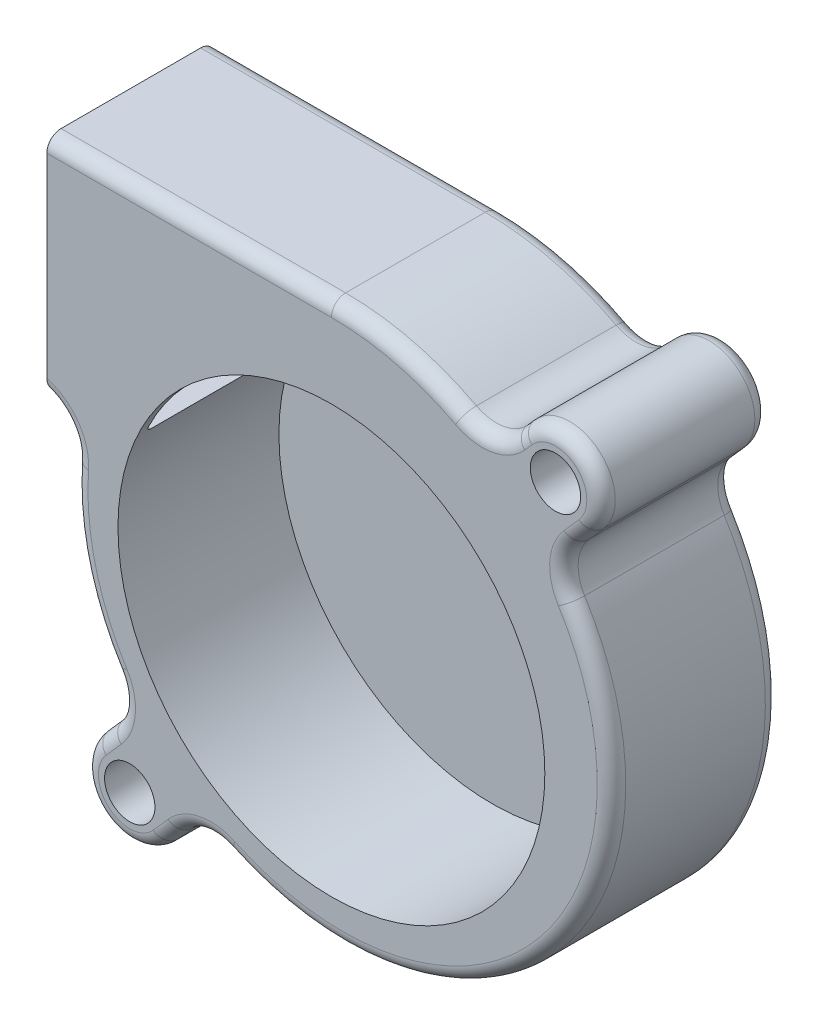
from build123d import *

# Parameters (mm, degrees)
SKETCH1_R           = 19.05
SKETCH1_R_2         = 2.2479
BOSS_EXTRUDE2_DEPTH = 15
FILLET1_R           = 3.81
FILLET2_R           = 1.27
SKETCH2_R           = 19.05
BOSS_EXTRUDE3_DEPTH = 0.635
CUT_EXTRUDE1_DEPTH  = 26.035


with BuildPart() as part:
    # Sketch1 → Boss-Extrude2 (new body)
    with BuildSketch(Plane.XY):
        with BuildLine():
            Line((-25.4, 7), (-25.4, 27))
            Line((-25.4, 27), (0, 27))
            ThreePointArc((0, 27), (7.440223944, 25.871137622), (14.210761067, 22.586158219))
            Line((14.210761067, 22.586158219), (16.954726597, 25.691171845))
            ThreePointArc((16.954726597, 25.691171845), (22.691171845, 26.045273403), (23.045273403, 20.308828155))
            Line((23.045273403, 20.308828155), (19.708510775, 16.533017813))
            ThreePointArc((19.708510775, 16.533017813), (18.983898052, -14.392747115), (-11.617963969, -18.915361503))
            Line((-11.617963969, -18.915361503), (-14.954726597, -22.691171845))
            ThreePointArc((-14.954726597, -22.691171845), (-20.691171845, -23.045273403), (-21.045273403, -17.308828155))
            Line((-21.045273403, -17.308828155), (-17.708510775, -13.533017813))
            ThreePointArc((-17.708510775, -13.533017813), (-22.406586632, -3.803932714), (-22.361292772, 7))
            Line((-22.361292772, 7), (-25.4, 7))
        make_face()
        Circle(SKETCH1_R, mode=Mode.SUBTRACT)
        with Locations((-18, -20)):
            Circle(SKETCH1_R_2, mode=Mode.SUBTRACT)
        with Locations((20, 23)):
            Circle(SKETCH1_R_2, mode=Mode.SUBTRACT)
    extrude(amount=BOSS_EXTRUDE2_DEPTH)

    # Fillet1
    # the kernel refuses this fillet: 3.81 mm, written as the material it adds along each edge
    with BuildSketch(Plane(origin=(14.210761067, 22.586158219, 0), x_dir=(-0.8559717678532165, 0.517022564921725, 0), z_dir=(0, 0, 1))) as fillet1_piece_1:
        with BuildLine():
            CenterArc((3.179243746, -3.803385338), FILLET1_R, 93.37669496, 76.288341739)
            Line((-0.568941844, -3.119861536), (-0.643905555, -3.10619106))
            Line((-0.643905555, -3.10619106), (-0.074963712, 0.013670476))
            Line((-0.074963712, 0.013670476), (0.004488206, 0.076067707))
            ThreePointArc((0.004488206, 0.076067707), (1.477416735, 0.032652027), (2.950345264, 0.076067707))
            Line((2.950345264, 0.076067707), (2.95483347, 0))
        make_face()
    extrude(amount=15)
    with BuildSketch(Plane(origin=(19.708510775, 16.533017813, 0), x_dir=(0.662197796471711, 0.7493290854811459, 0), z_dir=(0, 0, 1)), Plane(origin=(-17.708510775, -13.533017813, 0), x_dir=(-0.6621977964717104, -0.7493290854811463, 0), z_dir=(0, 0, 1))) as fillet1_piece_2:
        with BuildLine():
            CenterArc((3.018599897, -3.81), FILLET1_R, 90, 73.552565618)
            Line((-0.635494519, -2.731253506), (-0.708576407, -2.709678576))
            ThreePointArc((-0.708576407, -2.709678576), (-0.352039979, -1.357647693), (-0.075099583, 0.0129032))
            Line((-0.075099583, 0.0129032), (0, 0.0762))
            Line((0, 0.0762), (3.018599897, 0.0762))
            Line((3.018599897, 0.0762), (3.018599897, 0))
        make_face()
    extrude(amount=15)
    with BuildSketch(Plane(origin=(-11.617963969, -18.915361503, 0), x_dir=(0.8799019811914369, -0.4751552414689165, 0), z_dir=(0, 0, 1))) as fillet1_piece_3:
        with BuildLine():
            CenterArc((3.026795184, -3.803492639), FILLET1_R, 93.349187231, 73.552565618)
            Line((-0.684079668, -2.940064684), (-0.758297165, -2.922796125))
            Line((-0.758297165, -2.922796125), (-0.074217497, 0.017268559))
            Line((-0.074217497, 0.017268559), (0.004451685, 0.076069853))
            ThreePointArc((0.004451685, 0.076069853), (1.40210547, 0.035208749), (2.799759255, 0.076069853))
            Line((2.799759255, 0.076069853), (2.80421094, 0))
        make_face()
    extrude(amount=15)
    with BuildSketch(Plane(origin=(-22.361292772, 7, 0), x_dir=(-0.14985135420015194, -0.9887085372567492, 0), z_dir=(0, 0, 1))) as fillet1_piece_4:
        with BuildLine():
            CenterArc((4.18187782, -3.797568614), FILLET1_R, 94.629702487, 73.354472459)
            Line((0.455354393, -3.004395778), (0.380823925, -2.988532321))
            ThreePointArc((0.380823925, -2.988532321), (0.152337606, -1.513616562), (-0.075339591, -0.011418673))
            Line((-0.075339591, -0.011418673), (0.006150533, 0.075951372))
            ThreePointArc((0.006150533, 0.075951372), (1.937175597, -0.002107946), (3.868200662, 0.075951372))
            Line((3.868200662, 0.075951372), (3.874351194, 0))
        make_face()
    extrude(amount=15)

    # Fillet2
    fillet2_edges = [part.edges().sort_by_distance(p)[0] for p in [
        (-12.7, 27, 0),
        (16.632762316, 25.326843843, 0),
        (22.691171845, 26.045273403, 0),
        (-20.691171845, -23.045273403, 15),
        (-14.285800383, -21.934229024, 0),
        (-20.691171845, -23.045273403, 0),
        (-14.285800383, -21.934229024, 15),
        (22.691171845, 26.045273403, 15),
        (16.632762316, 25.326843843, 15),
        (-12.7, 27, 15),
        (6.016380372, 26.267781186, 0),
        (6.016380372, 26.267781186, 15),
        (22.37634719, 19.551885334, 0),
        (22.37634719, 19.551885334, 15),
        (18.983898052, -14.392747115, 0),
        (18.983898052, -14.392747115, 15),
        (-20.37634719, -16.551885334, 0),
        (-20.37634719, -16.551885334, 15),
        (-22.282212408, -4.325683257, 0),
        (-22.282212408, -4.325683257, 15),
        (14.142855385, 23.73793966, 0),
        (14.142855385, 23.73793966, 15),
        (20.765129655, 16.58358617, 0),
        (20.765129655, 16.58358617, 15),
        (-11.538196809, -19.970177987, 0),
        (-11.538196809, -19.970177987, 15),
        (-18.765129655, -13.58358617, 0),
        (-18.765129655, -13.58358617, 15),
        (-23.536076727, 5.492091628, 0),
        (-23.536076727, 5.492091628, 15),
    ]]
    fillet(fillet2_edges, radius=FILLET2_R)

    # Sketch2 → Boss-Extrude3 (add)
    with BuildSketch(Plane(origin=(0, 0, 0), x_dir=(-1, 0, 0), z_dir=(0, 0, -1))):
        Circle(SKETCH2_R)
    extrude(amount=-BOSS_EXTRUDE3_DEPTH)

    # Sketch4 → Cut-Extrude1 (cut)
    with BuildSketch(Plane.ZY.offset(25.4)):
        with BuildLine():
            Line((1.27, 7.8128), (13.73, 7.8128))
            add(Edge.make_bspline(
                [(13.73, 7.8128), (13.859068661, 7.8128), (13.979854215, 7.8815369), (14.14226404, 8.07875966), (14.1872, 8.205087608), (14.1872, 8.333771051)],
                knots=[0, 0, 0, 0, 0.5, 0.5, 1, 1, 1, 1], degree=3))
            Line((14.1872, 8.333771051), (14.1872, 25.73))
            ThreePointArc((14.1872, 25.73), (14.05328922, 26.05328922), (13.73, 26.1872))
            Line((13.73, 26.1872), (1.27, 26.1872))
            ThreePointArc((1.27, 26.1872), (0.94671078, 26.05328922), (0.8128, 25.73))
            Line((0.8128, 25.73), (0.8128, 8.333771051))
            add(Edge.make_bspline(
                [(0.8128, 8.333771051), (0.8128, 8.205019375), (0.856810484, 8.079606616), (0.979665893, 7.930755304), (1.028434999, 7.889741659), (1.142281289, 7.829657638), (1.205371656, 7.8128), (1.27, 7.8128)],
                knots=[0, 0, 0, 0, 0.5, 0.5, 0.75, 0.75, 1, 1, 1, 1], degree=3))
        make_face()
    extrude(amount=-CUT_EXTRUDE1_DEPTH, mode=Mode.SUBTRACT)


solid = part.part
